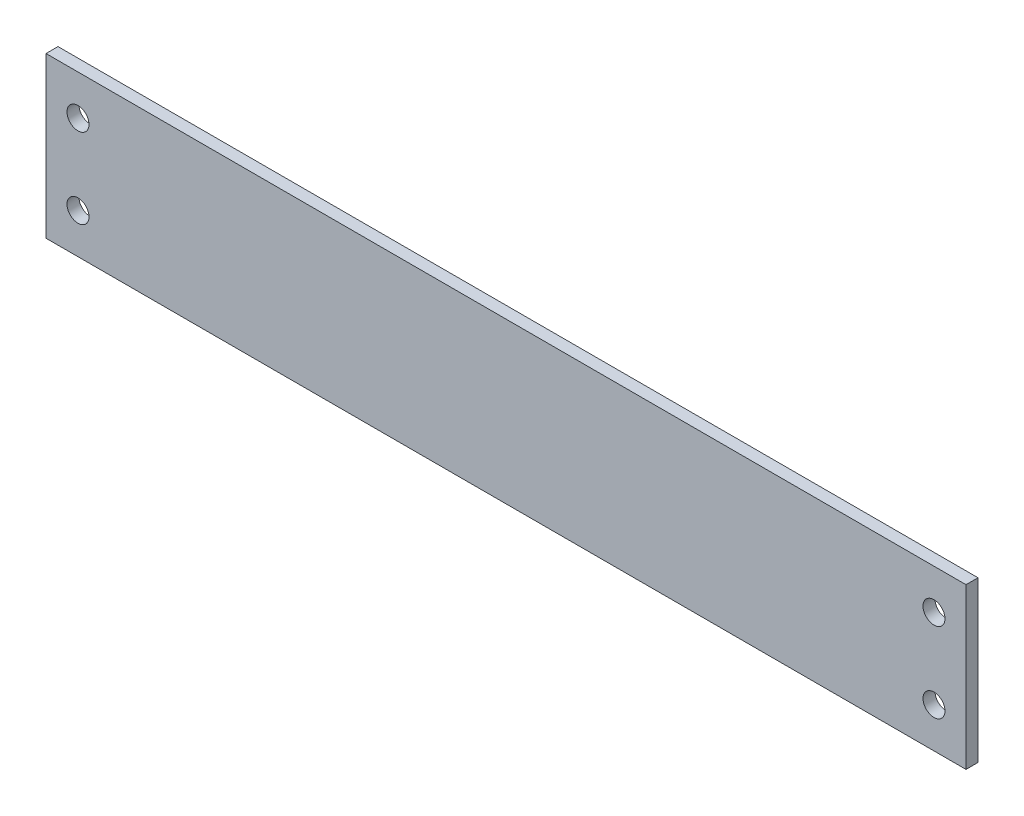
from build123d import *

# Parameters (mm, degrees)
EXTRUSION_BASE_SKETCH_W      = 230
EXTRUSION_BASE_SKETCH_H      = 40
EXTRUSION_BASE_EXTRUDE_DEPTH = 3
M5_MOUNTING_HOLES_D          = 5.5


with BuildPart() as part:
    # Extrusion Base Sketch → Extrusion Base Extrude (new body)
    with BuildSketch(Plane.XY):
        with Locations((93.75, 16.75)):
            Rectangle(EXTRUSION_BASE_SKETCH_W, EXTRUSION_BASE_SKETCH_H)
    extrude(amount=-EXTRUSION_BASE_EXTRUDE_DEPTH)

    # M5 Mounting Holes (through all)
    with Locations(Plane(origin=(0, 0, -3), x_dir=(-1, 0, 0), z_dir=(0, 0, -1))):
        with Locations((-200.75, 26.75), (-200.75, 6.75), (13.25, 26.75), (13.25, 6.75)):
            Hole(M5_MOUNTING_HOLES_D / 2)


solid = part.part
